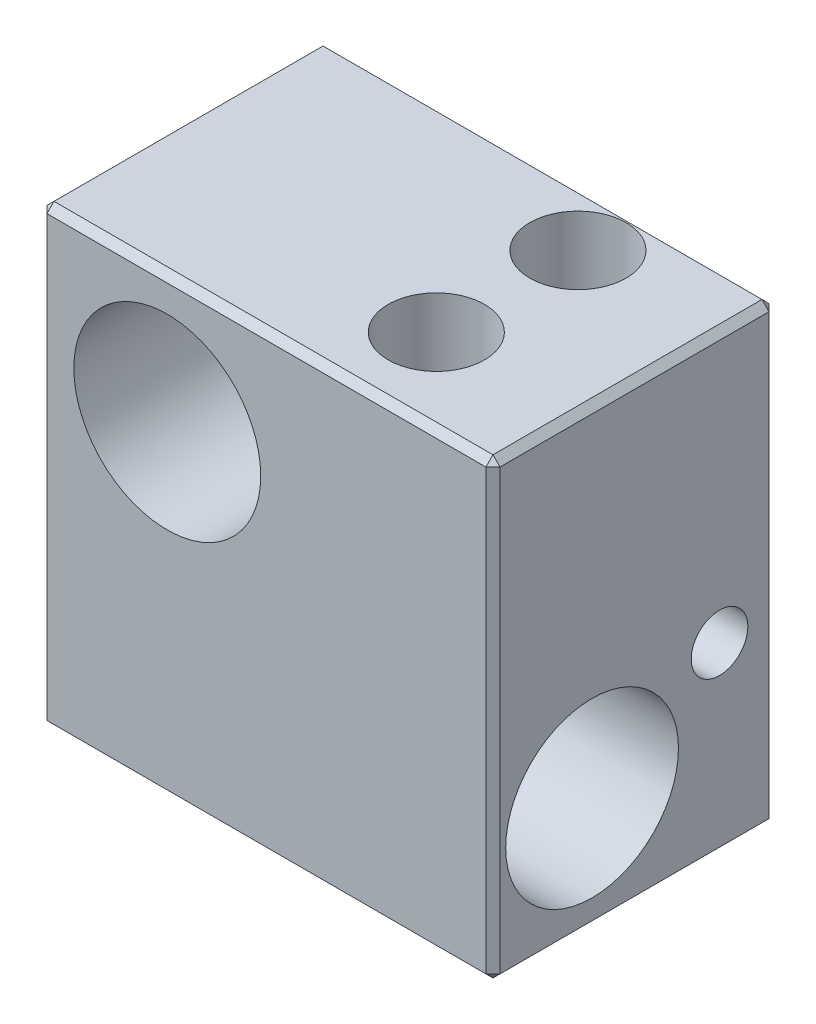
from build123d import *

# Parameters (mm, degrees)
ESQUISSE1_W                     = 16
ESQUISSE1_H                     = 16
BOSS_EXTRU_1_DEPTH              = 10
D_GAGEMENT_M61_D                = 6.6
DIAM_TRE_DU_PER_AGE_6_1_6_1_1_D = 6.1
DIAM_TRE_DU_PER_AGE_2_0_2_1_D   = 2
D_GAGEMENT_M31_D                = 3.4
D_GAGEMENT_M31_DEPTH            = 11
D_GAGEMENT_M31_TIP              = 1.021463052
D_GAGEMENT_M32_D                = 3.4
D_GAGEMENT_M32_DEPTH            = 9
D_GAGEMENT_M32_TIP              = 1.021463052
CHANFREIN1_SIZE                 = 0.25


with BuildPart() as part:
    # Esquisse1 → Boss.-Extru.1 (new body)
    with BuildSketch(Plane.XY):
        with Locations((8, 8)):
            Rectangle(ESQUISSE1_W, ESQUISSE1_H)
    extrude(amount=BOSS_EXTRU_1_DEPTH)

    # Dégagement M61 (through all)
    with Locations(Plane.XY.offset(10)):
        with Locations((4.5, 11.5)):
            Hole(D_GAGEMENT_M61_D / 2)

    # Diamètre du perçage Ø6.1 (6.1)1 (through all)
    with Locations(Plane(origin=(16, 0, 0), x_dir=(0, 0, -1), z_dir=(1, 0, 0))):
        with Locations((-6.5, 4)):
            Hole(DIAM_TRE_DU_PER_AGE_6_1_6_1_1_D / 2)

    # Diamètre du perçage Ø2.0 (2)1 (through all)
    with Locations(Plane(origin=(16, 0, 0), x_dir=(0, 0, -1), z_dir=(1, 0, 0))):
        with Locations((-2, 6.5)):
            Hole(DIAM_TRE_DU_PER_AGE_2_0_2_1_D / 2)

    # Dégagement M31
    with Locations(Plane(origin=(0, 16, 0), x_dir=(1, 0, 0), z_dir=(0, 1, 0))):
        with Locations((11, -7)):
            Hole(D_GAGEMENT_M31_D / 2, depth=D_GAGEMENT_M31_DEPTH)
            with Locations((0, 0, -(D_GAGEMENT_M31_DEPTH + D_GAGEMENT_M31_TIP / 2))):  # 118° drill point
                Cone(0, D_GAGEMENT_M31_D / 2, D_GAGEMENT_M31_TIP, mode=Mode.SUBTRACT)

    # Dégagement M32
    with Locations(Plane(origin=(0, 16, 0), x_dir=(1, 0, 0), z_dir=(0, 1, 0))):
        with Locations((11, -2)):
            Hole(D_GAGEMENT_M32_D / 2, depth=D_GAGEMENT_M32_DEPTH)
            with Locations((0, 0, -(D_GAGEMENT_M32_DEPTH + D_GAGEMENT_M32_TIP / 2))):  # 118° drill point
                Cone(0, D_GAGEMENT_M32_D / 2, D_GAGEMENT_M32_TIP, mode=Mode.SUBTRACT)

    # Chanfrein1
    chanfrein1_edges = [part.edges().sort_by_distance(p)[0] for p in [
        (0, 8, 0),
        (0, 8, 10),
        (8, 0, 10),
        (0, 0, 5),
        (8, 0, 0),
        (16, 8, 10),
        (16, 0, 5),
        (16, 8, 0),
        (8, 16, 10),
        (16, 16, 5),
        (8, 16, 0),
        (0, 16, 5),
    ]]
    chamfer(chanfrein1_edges, length=CHANFREIN1_SIZE)


solid = part.part
